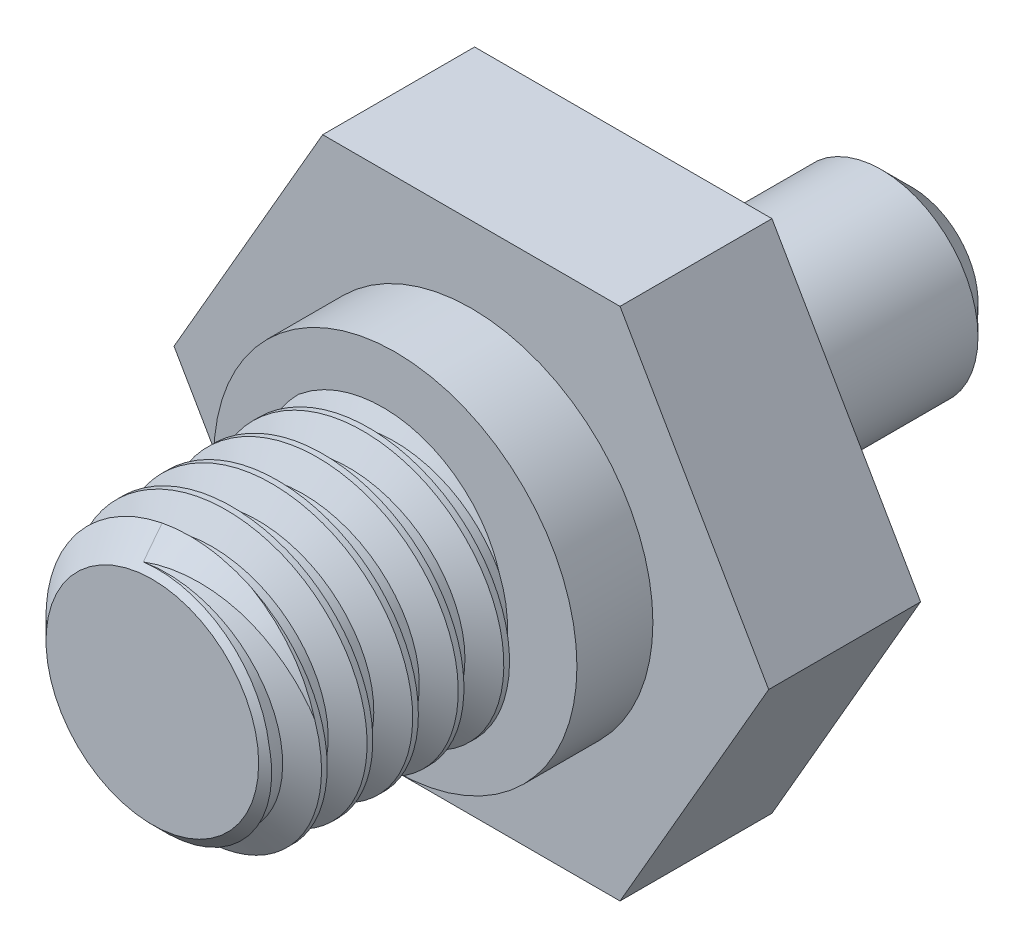
from build123d import *

# Parameters (mm, degrees)
BOSS_EXTRUDE1_DEPTH = 5
SKETCH4_R           = 5.975
BOSS_EXTRUDE3_DEPTH = 2.5
BOSS_EXTRUDE2_START = 2.5
SKETCH2_R           = 4.5
BOSS_EXTRUDE2_DEPTH = 8
CHAMFER1_SIZE       = 1
THREAD2_PITCH       = 1.5
THREAD2_TO          = 9
SKETCH5_R           = 3.175
BOSS_EXTRUDE4_DEPTH = 9.5
CHAMFER2_SIZE       = 1
FILLET1_R           = 1


with BuildPart() as part:
    # Sketch1 → Boss-Extrude1 (new body)
    with BuildSketch(Plane.XY):
        Polygon((4.893043531, 8.475), (-4.893043531, 8.475), (-9.786087063, 0), (-4.893043531, -8.475), (4.893043531, -8.475), (9.786087063, 0), align=None)
    extrude(amount=BOSS_EXTRUDE1_DEPTH)

    # Sketch4 → Boss-Extrude3 (add)
    with BuildSketch(Plane.XY.offset(5)):
        Circle(SKETCH4_R)
    extrude(amount=BOSS_EXTRUDE3_DEPTH)

    # Sketch2 → Boss-Extrude2 (add)
    with BuildSketch(Plane.XY.offset(5).offset(BOSS_EXTRUDE2_START)):
        Circle(SKETCH2_R)
    extrude(amount=BOSS_EXTRUDE2_DEPTH)

    # Chamfer1
    chamfer1_edges = [part.edges().sort_by_distance(p)[0] for p in [
        (-4.5, 0, 15.5),
    ]]
    chamfer(chamfer1_edges, length=CHAMFER1_SIZE)

    # Thread2: arcs per turn and ends read off the stored shape
    # Thread2: the profile of Thread Profile2 profile screwed along a right-hand helix through 6 turns, 8 arcs to a turn; built about Z, then put on its axis
    thread2_z = Axis((0, 0, 0), (0, 0, 1))
    thread2_corners = [(4.5003, 0, -0.000173205), (4.5003, 0, 1.312673201), (3.688101188, 0, 0.843749998), (3.688101188, 0, 0.468749998)]
    with BuildLine(mode=Mode.PRIVATE) as thread2_profile:
        Line(thread2_corners[0], thread2_corners[1])
        Line(thread2_corners[1], thread2_corners[2])
        Line(thread2_corners[2], thread2_corners[3])
        Line(thread2_corners[3], thread2_corners[0])
    thread2_cap = Face(thread2_profile.wire())
    thread2_turn_angles = [0, 22.5, 45, 67.5, 90, 112.5, 135, 157.5, 180, 202.5, 225, 247.5, 270, 292.5, 315, 337.5, 360]
    thread2_turn_weights = [1, 0.9238795325112867, 1, 0.9238795325112867, 1, 0.9238795325112867, 1, 0.9238795325112867, 1, 0.9238795325112867, 1, 0.9238795325112867, 1, 0.9238795325112867, 1, 0.9238795325112867, 1]
    thread2_turn_rails = [Edge.make_bspline([Vector(p[0], p[1], 0).rotate(thread2_z, thread2_turn_angles[k]) / thread2_turn_weights[k] + Vector(0, 0, p[2] + THREAD2_PITCH * thread2_turn_angles[k] / 360) for k in range(17)], [0, 0, 0, 1, 1, 2, 2, 3, 3, 4, 4, 5, 5, 6, 6, 7, 7, 8, 8, 8], 2, thread2_turn_weights) for p in thread2_corners]
    thread2_turn_sides = [Face.make_surface_from_curves(thread2_turn_rails[p[0]], thread2_turn_rails[p[1]]) for p in [(0, 1), (1, 2), (2, 3), (3, 0)]]
    thread2 = Plane(origin=(0, 0, 16.5), x_dir=(-1, 0, 0), z_dir=(0, 0, -1)) * split(Solid(Shell([*[p.moved(Location((0, 0, THREAD2_PITCH * i))) for i in range(6) for p in thread2_turn_sides], thread2_cap, thread2_cap.rotate(thread2_z, 2160).moved(Location((0, 0, THREAD2_PITCH * 2160 / 360)))])), bisect_by=Plane.XY.offset(THREAD2_TO), keep=Keep.BOTTOM, mode=Mode.PRIVATE)
    add(thread2, mode=Mode.SUBTRACT)

    # Sketch5 → Boss-Extrude4 (add)
    with BuildSketch(Plane(origin=(0, 0, 0), x_dir=(-1, 0, 0), z_dir=(0, 0, -1))):
        Circle(SKETCH5_R)
    extrude(amount=BOSS_EXTRUDE4_DEPTH)

    # Chamfer2
    chamfer2_edges = [part.edges().sort_by_distance(p)[0] for p in [
        (3.175, 0, -9.5),
    ]]
    chamfer(chamfer2_edges, length=CHAMFER2_SIZE)

    # Fillet1
    fillet1_edges = [part.edges().sort_by_distance(p)[0] for p in [
        (3.175, 0, 0),
    ]]
    fillet(fillet1_edges, radius=FILLET1_R)


solid = part.part
